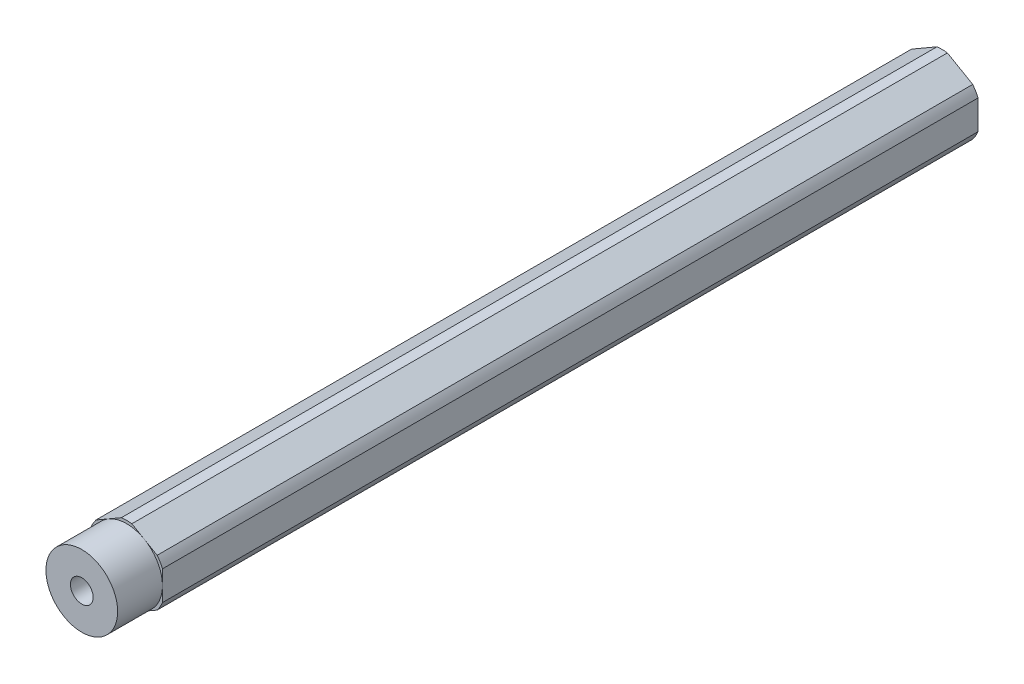
from build123d import *

# Parameters (mm, degrees)
SKETCH1_R           = 2.0193
BOSS_EXTRUDE1_DEPTH = 72.23125
SKETCH2_R           = 6.35
SKETCH2_R_2         = 2.0193
BOSS_EXTRUDE2_DEPTH = 7.9375


with BuildPart() as part:
    # Sketch1 → Boss-Extrude1 (new, symmetric)
    with BuildSketch(Plane.XY):
        with BuildLine():
            ThreePointArc((0.93173274, 6.79441227), (0, 6.858), (-0.93173274, 6.79441227))
            Line((-0.93173274, 6.79441227), (-5.41826726, 4.204110358))
            ThreePointArc((-5.41826726, 4.204110358), (-5.939202219, 3.429), (-6.35, 2.590301913))
            Line((-6.35, 2.590301913), (-6.35, -2.590301913))
            ThreePointArc((-6.35, -2.590301913), (-5.939202219, -3.429), (-5.41826726, -4.204110358))
            Line((-5.41826726, -4.204110358), (-0.93173274, -6.79441227))
            ThreePointArc((-0.93173274, -6.79441227), (0, -6.858), (0.93173274, -6.79441227))
            Line((0.93173274, -6.79441227), (5.41826726, -4.204110358))
            ThreePointArc((5.41826726, -4.204110358), (5.939202219, -3.429), (6.35, -2.590301913))
            Line((6.35, -2.590301913), (6.35, 2.590301913))
            ThreePointArc((6.35, 2.590301913), (5.939202219, 3.429), (5.41826726, 4.204110358))
            Line((5.41826726, 4.204110358), (0.93173274, 6.79441227))
        make_face()
        Circle(SKETCH1_R, mode=Mode.SUBTRACT)
    extrude(amount=BOSS_EXTRUDE1_DEPTH, both=True)

    # Sketch2 → Boss-Extrude2 (add)
    with BuildSketch(Plane.XY.offset(72.23125)):
        Circle(SKETCH2_R)
        Circle(SKETCH2_R_2, mode=Mode.SUBTRACT)
    extrude(amount=BOSS_EXTRUDE2_DEPTH)


solid = part.part
